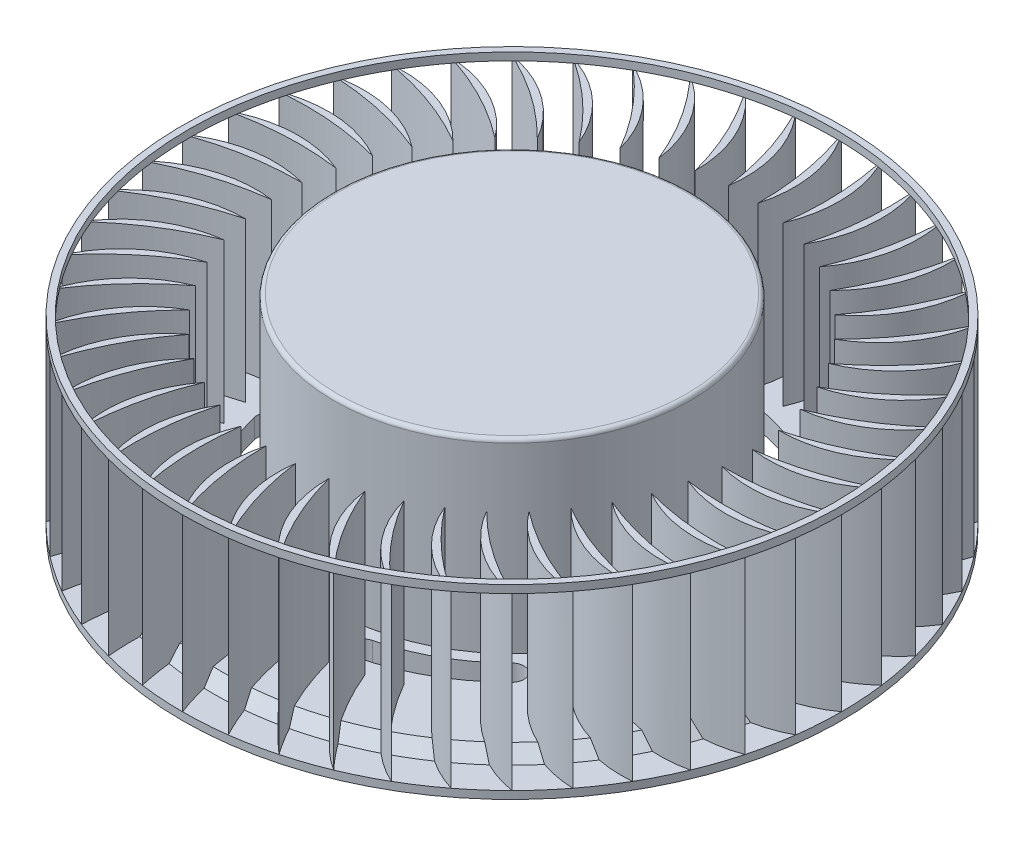
from build123d import *

# Parameters (mm, degrees)
SKETCH_1_R               = 42.5
EXTRUDE_1_DEPTH          = 1
SKETCH_2_R               = 38.5
EXTRUDE_2_DEPTH          = 1.5
CHAMFER_1_SIZE           = 1.5
SKETCH_3_R               = 23
EXTRUDE_3_DEPTH          = 24
FILLET_1_R               = 0.5
EXTRUDE_4_DEPTH          = 23
PATTERN_CIRCULAR_1_COUNT = 48
SKETCH_5_R               = 20
CUT_EXTRUDE_1_DEPTH      = 1.2
CHAMFER_2_SIZE           = 1.2
SKETCH_6_R               = 20
CUT_EXTRUDE_2_DEPTH      = 8.5
CORTE_EXTRUS_O1_DEPTH    = 10
ESBO_O3_R                = 42.5
ESBO_O3_R_2              = 41.65783768
RESSALTO_EXTRUS_O6_DEPTH = 1


with BuildPart() as part:
    # Эскиз1 → Бобышка-Вытянуть1 (new body)
    with BuildSketch(Plane(origin=(0, 0, 0), x_dir=(1, 0, 0), z_dir=(0, 1, 0))):
        with Locations(Location((0, 0, 0), (0, 0, 270))):
            Circle(SKETCH_1_R)
    extrude(amount=EXTRUDE_1_DEPTH)

    # Эскиз2 → Бобышка-Вытянуть2 (add)
    with BuildSketch(Plane(origin=(0, 1, 0), x_dir=(1, 0, 0), z_dir=(0, 1, 0))):
        with Locations(Location((0, 0, 0), (0, 0, 270))):
            Circle(SKETCH_2_R)
    extrude(amount=EXTRUDE_2_DEPTH)

    # Фаска1
    chamfer_1_edges = [part.edges().sort_by_distance(p)[0] for p in [
        (0, 2.5, -38.5),
    ]]
    chamfer(chamfer_1_edges, length=CHAMFER_1_SIZE - 0.0001)  # a hair under: the kernel refuses the full size

    # Эскиз3 → Бобышка-Вытянуть3 (add)
    with BuildSketch(Plane(origin=(0, 2.5, 0), x_dir=(1, 0, 0), z_dir=(0, 1, 0))):
        with Locations(Location((0, 0, 0), (0, 0, 270))):
            Circle(SKETCH_3_R)
    extrude(amount=EXTRUDE_3_DEPTH)

    # Скругление1
    fillet_1_edges = [part.edges().sort_by_distance(p)[0] for p in [
        (0, 26.5, -23),
    ]]
    fillet(fillet_1_edges, radius=FILLET_1_R)

    # Эскиз4 → Бобышка-Вытянуть4 (add)
    with BuildSketch(Plane(origin=(0, 0, 0), x_dir=(1, 0, 0), z_dir=(0, 1, 0))):
        with BuildLine():
            ThreePointArc((0, 42.5), (1.744983527, 36.058968939), (2.30819775, 29.409560064))
            ThreePointArc((2.30819775, 29.409560064), (2.631310505, 36.215252298), (0, 42.5))
        make_face()
    extrude_4 = extrude(amount=EXTRUDE_4_DEPTH)

    # Круговой массив1: Бобышка-Вытянуть4 ×48 about axis
    pattern_circular_1_axis = Axis((0, 0, 0), (0, 1, 0))
    for i in range(1, PATTERN_CIRCULAR_1_COUNT):
        add(extrude_4.rotate(pattern_circular_1_axis, i * 360 / PATTERN_CIRCULAR_1_COUNT))

    # Эскиз5 → Вырез-Вытянуть1 (cut)
    with BuildSketch(Plane.XZ):
        with Locations(Location((0, 0, 0), (0, 0, 270))):
            Circle(SKETCH_5_R)
    extrude(amount=-CUT_EXTRUDE_1_DEPTH, mode=Mode.SUBTRACT)

    # Фаска2
    chamfer_2_edges = [part.edges().sort_by_distance(p)[0] for p in [
        (0, 0, 20),
    ]]
    chamfer(chamfer_2_edges, length=CHAMFER_2_SIZE - 0.0001)  # a hair under: the kernel refuses the full size

    # Эскиз6 → Вырез-Вытянуть2 (cut)
    with BuildSketch(Plane.XZ.offset(-1.2)):
        with Locations(Location((0, 0, 0), (0, 0, 270))):
            Circle(SKETCH_6_R)
    extrude(amount=-CUT_EXTRUDE_2_DEPTH, mode=Mode.SUBTRACT)

    # Esboço1 → Corte-extrusão1 (cut)
    with BuildSketch(Plane(origin=(0, 2.5, 0), x_dir=(1, 0, 0), z_dir=(0, 1, 0))):
        with BuildLine():
            ThreePointArc((14.334200734, 23.49974675), (7.444527121, 26.500687236), (0, 27.526485573))
            ThreePointArc((0, 27.526485573), (-1.526485573, 26), (0, 24.473514427))
            ThreePointArc((0, 24.473514427), (6.618852284, 23.561487704), (12.744390036, 20.893382469))
            ThreePointArc((12.744390036, 20.893382469), (14.842477525, 21.401659261), (14.334200734, 23.49974675))
        make_face()
        with BuildLine():
            ThreePointArc((26.752640825, 6.481019741), (24.002891261, 13.47474004), (19.464164611, 19.464164611))
            ThreePointArc((19.464164611, 19.464164611), (17.305388011, 19.464164611), (17.305388011, 17.305388011))
            ThreePointArc((17.305388011, 17.305388011), (21.340723064, 11.980252397), (23.785497042, 5.76220781))
            ThreePointArc((23.785497042, 5.76220781), (25.6284749, 4.638041884), (26.752640825, 6.481019741))
        make_face()
        with BuildLine():
            ThreePointArc((23.49974675, -14.334200734), (26.500687236, -7.444527121), (27.526485573, 0))
            ThreePointArc((27.526485573, 0), (26, 1.526485573), (24.473514427, 0))
            ThreePointArc((24.473514427, 0), (23.561487704, -6.618852284), (20.893382469, -12.744390036))
            ThreePointArc((20.893382469, -12.744390036), (21.401659261, -14.842477525), (23.49974675, -14.334200734))
        make_face()
        with BuildLine():
            ThreePointArc((6.481019741, -26.752640825), (13.47474004, -24.002891261), (19.464164611, -19.464164611))
            ThreePointArc((19.464164611, -19.464164611), (19.464164611, -17.305388011), (17.305388011, -17.305388011))
            ThreePointArc((17.305388011, -17.305388011), (11.980252397, -21.340723064), (5.76220781, -23.785497042))
            ThreePointArc((5.76220781, -23.785497042), (4.638041884, -25.6284749), (6.481019741, -26.752640825))
        make_face()
        with BuildLine():
            ThreePointArc((-14.334200734, -23.49974675), (-7.444527121, -26.500687236), (0, -27.526485573))
            ThreePointArc((0, -27.526485573), (1.526485573, -26), (0, -24.473514427))
            ThreePointArc((0, -24.473514427), (-6.618852284, -23.561487704), (-12.744390036, -20.893382469))
            ThreePointArc((-12.744390036, -20.893382469), (-14.842477525, -21.401659261), (-14.334200734, -23.49974675))
        make_face()
        with BuildLine():
            ThreePointArc((-26.752640825, -6.481019741), (-24.002891261, -13.47474004), (-19.464164611, -19.464164611))
            ThreePointArc((-19.464164611, -19.464164611), (-17.305388011, -19.464164611), (-17.305388011, -17.305388011))
            ThreePointArc((-17.305388011, -17.305388011), (-21.340723064, -11.980252397), (-23.785497042, -5.76220781))
            ThreePointArc((-23.785497042, -5.76220781), (-25.6284749, -4.638041884), (-26.752640825, -6.481019741))
        make_face()
        with BuildLine():
            ThreePointArc((-23.49974675, 14.334200734), (-26.500687236, 7.444527121), (-27.526485573, 0))
            ThreePointArc((-27.526485573, 0), (-26, -1.526485573), (-24.473514427, 0))
            ThreePointArc((-24.473514427, 0), (-23.561487704, 6.618852284), (-20.893382469, 12.744390036))
            ThreePointArc((-20.893382469, 12.744390036), (-21.401659261, 14.842477525), (-23.49974675, 14.334200734))
        make_face()
        with BuildLine():
            ThreePointArc((-6.481019741, 26.752640825), (-13.47474004, 24.002891261), (-19.464164611, 19.464164611))
            ThreePointArc((-19.464164611, 19.464164611), (-19.464164611, 17.305388011), (-17.305388011, 17.305388011))
            ThreePointArc((-17.305388011, 17.305388011), (-11.980252397, 21.340723064), (-5.76220781, 23.785497042))
            ThreePointArc((-5.76220781, 23.785497042), (-4.638041884, 25.6284749), (-6.481019741, 26.752640825))
        make_face()
    extrude(amount=-CORTE_EXTRUS_O1_DEPTH, mode=Mode.SUBTRACT)

    # Esboço3 → Ressalto-extrusão6 (add)
    with BuildSketch(Plane(origin=(0, 23, 0), x_dir=(1, 0, 0), z_dir=(0, 1, 0))):
        with Locations(Location((0, 0, 0), (0, 0, 270))):
            Circle(ESBO_O3_R)
        with Locations(Location((0, 0, 0), (0, 0, 89.586421021))):
            Circle(ESBO_O3_R_2, mode=Mode.SUBTRACT)
    extrude(amount=RESSALTO_EXTRUS_O6_DEPTH)


solid = part.part
